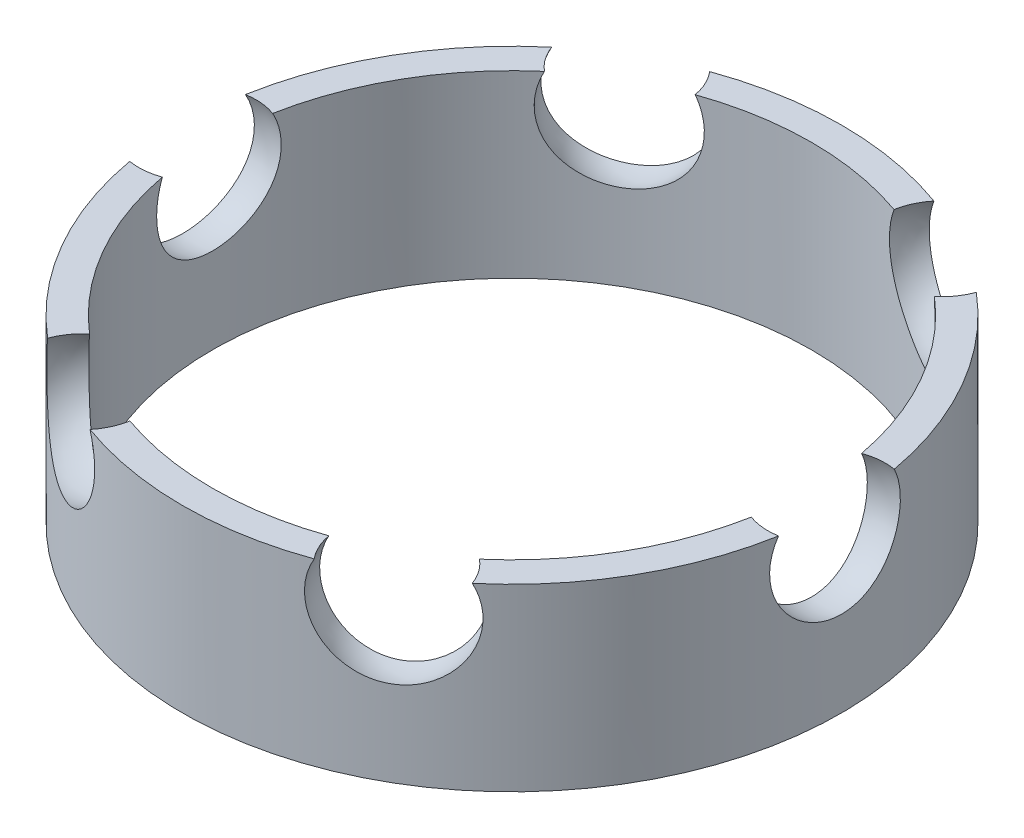
from build123d import *

# Parameters (mm, degrees)
SKETCH3_W          = 1
SKETCH3_H          = 10
CIRPATTERN1_COUNT  = 6
SKETCH5_R          = 11
SKETCH5_R_2        = 10
CUT_EXTRUDE1_DEPTH = 4


with BuildPart() as part:
    # Sketch3 → Revolve3 (revolve)
    with BuildSketch(Plane.XY):
        with Locations((10.5, 0)):
            Rectangle(SKETCH3_W, SKETCH3_H)
    revolve(axis=Axis((0, 0, 0), (0, 1, 0)))

    # Sketch4 → Cut-Revolve1 (revolve, cut)
    with BuildSketch(Plane.XY):
        with BuildLine():
            Line((10.5, 2.2), (10.5, -2.2))
            ThreePointArc((10.5, -2.2), (12.055634919, -1.555634919), (12.7, 0))
            ThreePointArc((12.7, 0), (12.055634919, 1.555634919), (10.5, 2.2))
        make_face()
    cut_revolve1 = revolve(axis=Axis((10.5, -2.2, 0), (0, 1, 0)), mode=Mode.SUBTRACT)

    # CirPattern1: Cut-Revolve1 ×6 about axis
    cirpattern1_axis = Axis((0, 5, 0), (0, -1, 0))
    for i in range(1, CIRPATTERN1_COUNT):
        add(cut_revolve1.rotate(cirpattern1_axis, i * 360 / CIRPATTERN1_COUNT), mode=Mode.SUBTRACT)

    # Sketch5 → Cut-Extrude1 (cut)
    with BuildSketch(Plane(origin=(0, 5, 0), x_dir=(1, 0, 0), z_dir=(0, 1, 0))):
        Circle(SKETCH5_R)
        Circle(SKETCH5_R_2, mode=Mode.SUBTRACT)
    extrude(amount=-CUT_EXTRUDE1_DEPTH, mode=Mode.SUBTRACT)


solid = part.part
